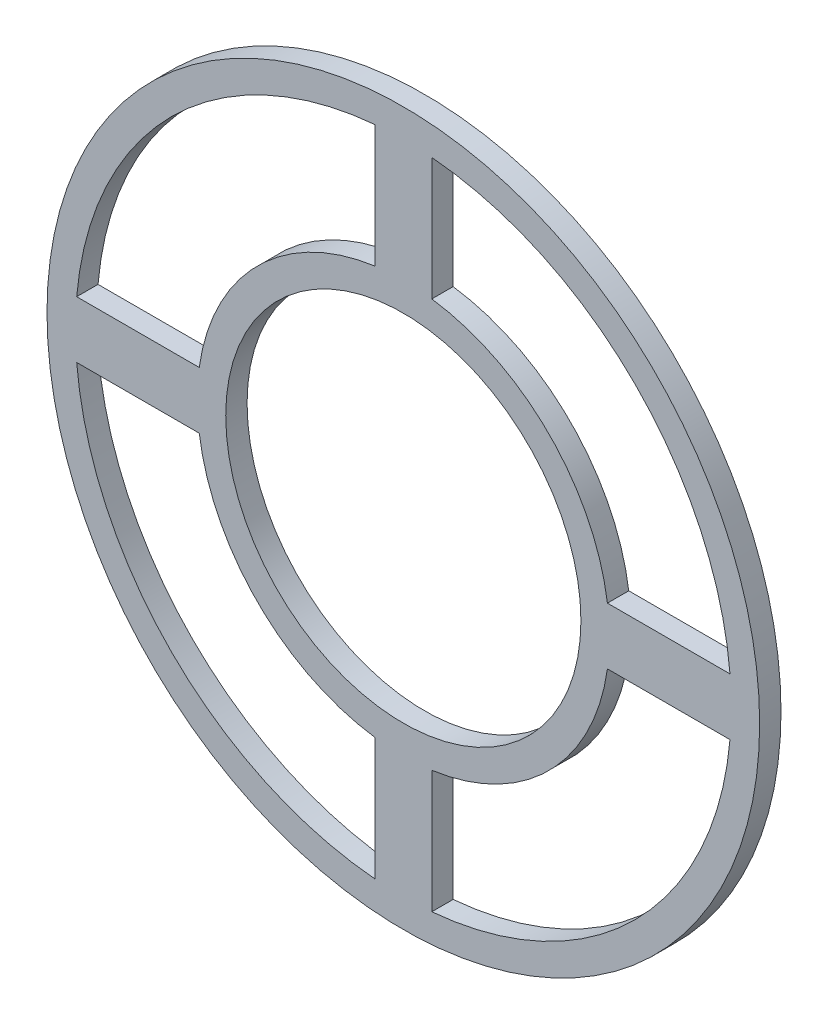
from build123d import *

# Parameters (mm, degrees)
SKETCH1_R           = 79.502
SKETCH1_R_2         = 39.624
BOSS_EXTRUDE1_DEPTH = 4.7625


with BuildPart() as part:
    # Sketch1 → Boss-Extrude1 (new body)
    with BuildSketch(Plane.XY):
        Circle(SKETCH1_R)
        with BuildLine():
            Line((-72.875871206, -6.35), (-45.533352347, -6.35))
            ThreePointArc((-45.533352347, -6.35), (-32.508527158, -32.508527158), (-6.35, -45.533352347))
            Line((-6.35, -45.533352347), (-6.35, -72.875871206))
            ThreePointArc((-6.35, -72.875871206), (-51.726275257, -51.726275257), (-72.875871206, -6.35))
        make_face(mode=Mode.SUBTRACT)
        with BuildLine():
            Line((45.533352347, -6.35), (72.875871206, -6.35))
            ThreePointArc((72.875871206, -6.35), (51.726275257, -51.726275257), (6.35, -72.875871206))
            Line((6.35, -72.875871206), (6.35, -45.533352347))
            ThreePointArc((6.35, -45.533352347), (32.508527158, -32.508527158), (45.533352347, -6.35))
        make_face(mode=Mode.SUBTRACT)
        with BuildLine():
            Line((-6.35, 72.875871206), (-6.35, 45.533352347))
            ThreePointArc((-6.35, 45.533352347), (-32.508527158, 32.508527158), (-45.533352347, 6.35))
            Line((-45.533352347, 6.35), (-72.875871206, 6.35))
            ThreePointArc((-72.875871206, 6.35), (-51.726275257, 51.726275257), (-6.35, 72.875871206))
        make_face(mode=Mode.SUBTRACT)
        Circle(SKETCH1_R_2, mode=Mode.SUBTRACT)
        with BuildLine():
            ThreePointArc((45.533352347, 6.35), (32.508527158, 32.508527158), (6.35, 45.533352347))
            Line((6.35, 45.533352347), (6.35, 72.875871206))
            ThreePointArc((6.35, 72.875871206), (51.726275257, 51.726275257), (72.875871206, 6.35))
            Line((72.875871206, 6.35), (45.533352347, 6.35))
        make_face(mode=Mode.SUBTRACT)
    extrude(amount=BOSS_EXTRUDE1_DEPTH)


solid = part.part
